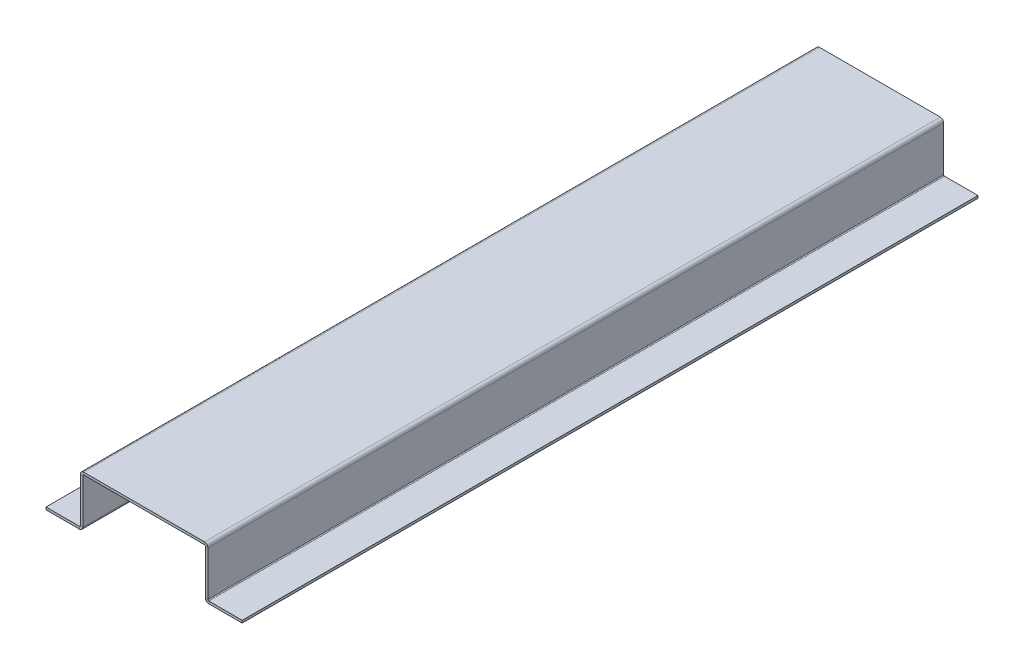
from build123d import *

# Parameters (mm, degrees)
BASE_FLANGE1_DEPTH = 300


# Sheet-metal steps are written as plain solids
with BuildPart() as part:
    # Sketch1 → Base-Flange1 (new, symmetric)
    with BuildSketch(Plane.XY):
        with BuildLine():
            Line((-80, -40), (-52.7366, -40))
            ThreePointArc((-52.7366, -40), (-50.801531583, -39.198468417), (-50, -37.2634))
            Line((-50, -37.2634), (-50, -0.7366))
            ThreePointArc((-50, -0.7366), (-49.784254855, -0.215745145), (-49.2634, 0))
            Line((-49.2634, 0), (49.2634, 0))
            ThreePointArc((49.2634, 0), (49.784254855, -0.215745145), (50, -0.7366))
            Line((50, -0.7366), (50, -37.2634))
            ThreePointArc((50, -37.2634), (50.801531583, -39.198468417), (52.7366, -40))
            Line((52.7366, -40), (80, -40))
            Line((80, -40), (80, -38))
            Line((80, -38), (52.7366, -38))
            ThreePointArc((52.7366, -38), (52.215745145, -37.784254855), (52, -37.2634))
            Line((52, -37.2634), (52, -0.7366))
            ThreePointArc((52, -0.7366), (51.198468417, 1.198468417), (49.2634, 2))
            Line((49.2634, 2), (-49.2634, 2))
            ThreePointArc((-49.2634, 2), (-51.198468417, 1.198468417), (-52, -0.7366))
            Line((-52, -0.7366), (-52, -37.2634))
            ThreePointArc((-52, -37.2634), (-52.215745145, -37.784254855), (-52.7366, -38))
            Line((-52.7366, -38), (-80, -38))
            Line((-80, -38), (-80, -40))
        make_face()
    extrude(amount=BASE_FLANGE1_DEPTH, both=True)


solid = part.part
